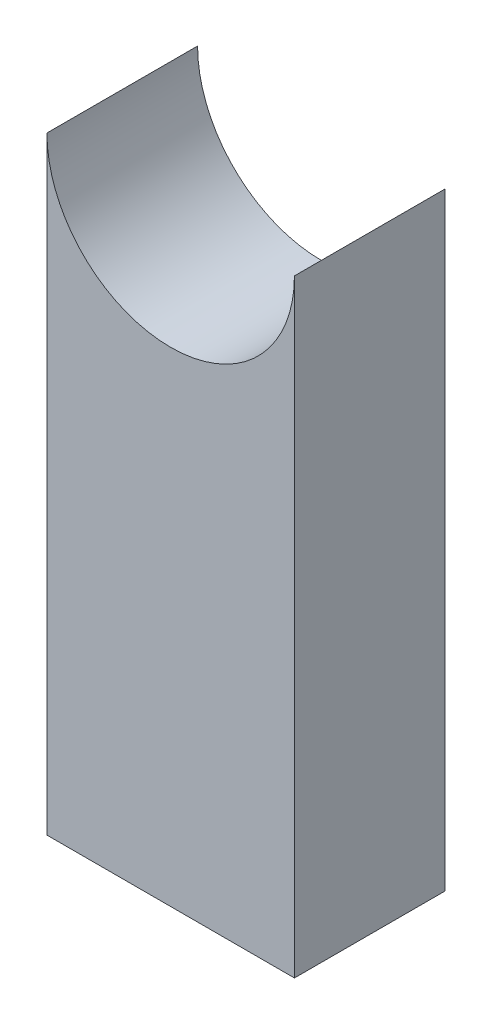
from build123d import *

# Parameters (mm, degrees)
BOSS_EXTRUDE1_DEPTH = 17.78


with BuildPart() as part:
    # Sketch1 → Boss-Extrude1 (new body)
    with BuildSketch(Plane.XY):
        with BuildLine():
            ThreePointArc((14.605, 0), (0, -14.605), (-14.605, 0))
            Line((-14.605, 0), (-14.605, -71.755))
            Line((-14.605, -71.755), (14.605, -71.755))
            Line((14.605, -71.755), (14.605, 0))
        make_face()
    extrude(amount=BOSS_EXTRUDE1_DEPTH)


solid = part.part
